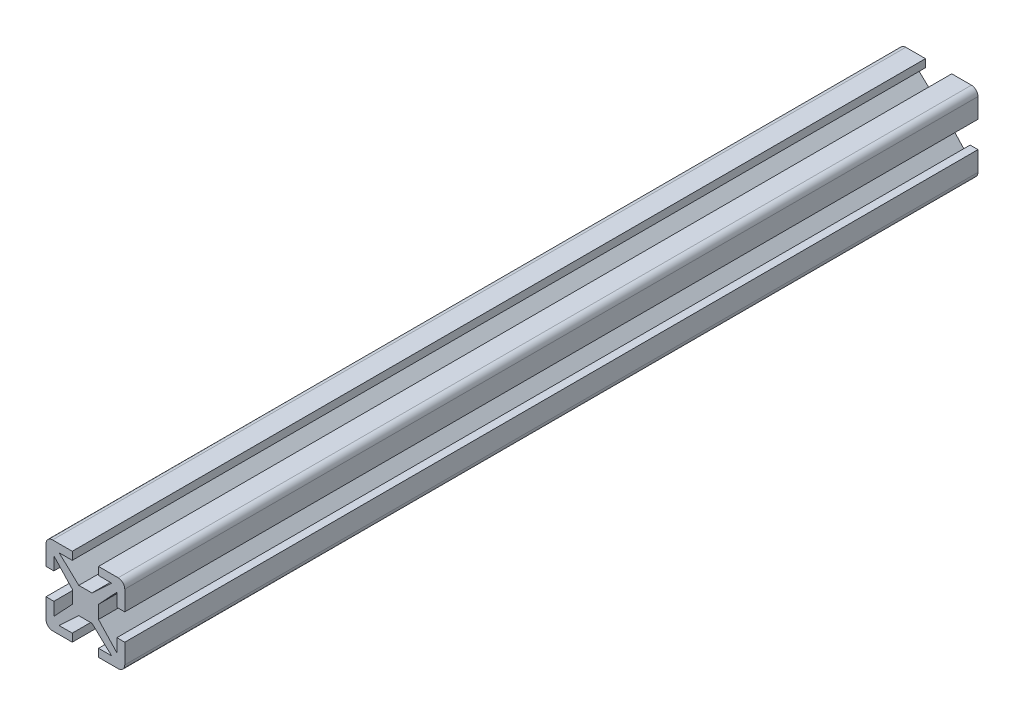
from build123d import *

# Parameters (mm, degrees)
EXTRUSION1_DEPTH             = 65
ENL_V_MAT_EXTRU_1_DEPTH      = 131.276628756
R_P_TITION_CIRCULAIRE1_COUNT = 4


with BuildPart() as part:
    # Esquisse1 → Extrusion1 (new, symmetric)
    with BuildSketch(Plane.XY):
        with BuildLine():
            Line((-6, 5), (-6, -5))
            ThreePointArc((-6, -5), (-5.707106781, -5.707106781), (-5, -6))
            Line((-5, -6), (5, -6))
            ThreePointArc((5, -6), (5.707106781, -5.707106781), (6, -5))
            Line((6, -5), (6, 5))
            ThreePointArc((6, 5), (5.707106781, 5.707106781), (5, 6))
            Line((5, 6), (-5, 6))
            ThreePointArc((-5, 6), (-5.707106781, 5.707106781), (-6, 5))
        make_face()
    extrude(amount=EXTRUSION1_DEPTH, both=True)

    # Esquisse3 → Enlèv. mat.-Extru.1 (cut, through all)
    with BuildSketch(Plane.XY.offset(65)):
        Polygon((6, 2), (4.8, 2), (4.8, 4), (2, 1), (2, -1), (4.8, -4), (4.8, -2), (6, -2), align=None)
    enl_v_mat_extru_1 = extrude(amount=-ENL_V_MAT_EXTRU_1_DEPTH, mode=Mode.SUBTRACT)

    # Répétition circulaire1: Enlèv. mat.-Extru.1 ×4 about axis
    r_p_tition_circulaire1_axis = Axis((0, 0, -1), (0, 0, 1))
    for i in range(1, R_P_TITION_CIRCULAIRE1_COUNT):
        add(enl_v_mat_extru_1.rotate(r_p_tition_circulaire1_axis, i * 360 / R_P_TITION_CIRCULAIRE1_COUNT), mode=Mode.SUBTRACT)


solid = part.part
